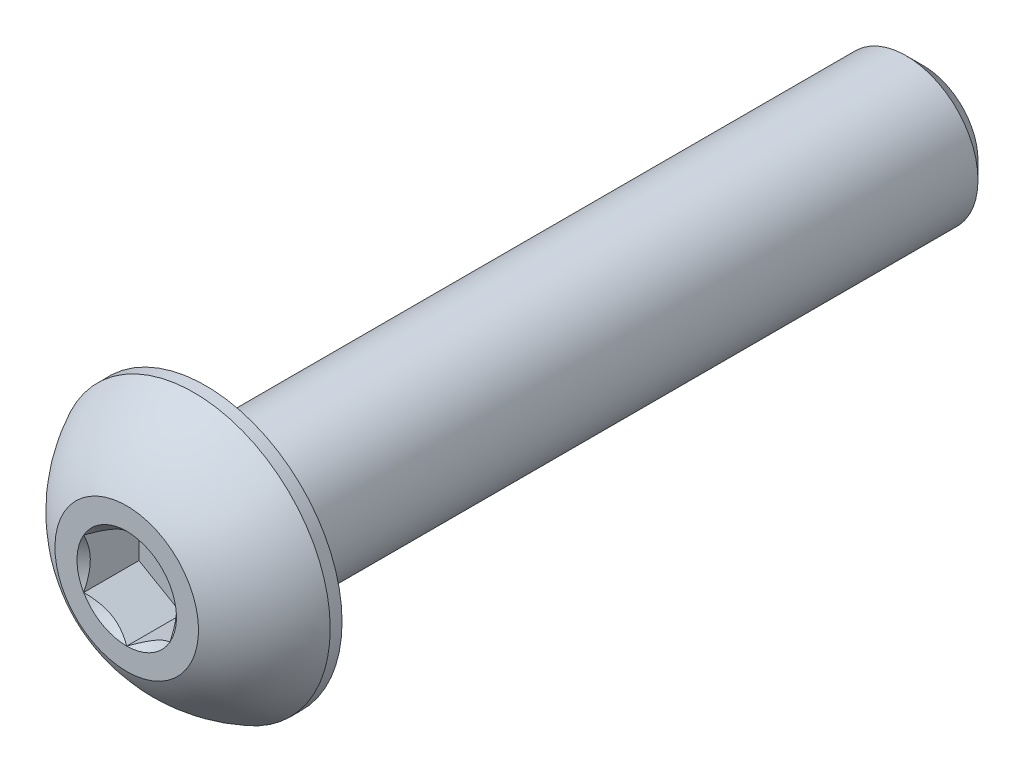
from build123d import *

# Parameters (mm, degrees)
CUT_EXTRUDE2_DEPTH = 1.925


with BuildPart() as part:
    # Sketch10 → Revolve3 (revolve)
    with BuildSketch(Plane(origin=(0, 0, 0), x_dir=(0, 0, -1), z_dir=(1, 0, 0)), mode=Mode.PRIVATE) as revolve3_sk:
        Polygon((27.15, 2.5), (27.75, 1.9), (27.75, 0), (2.75, 0), (2.75, 2.5), align=None)
    revolve(revolve3_sk.sketch.rotate(Axis((0, 0, 0), (0, 0, -1)), 90), axis=Axis((0, 0, 0), (0, 0, -1)))

    # Sketch7 → Revolve2 (revolve)
    with BuildSketch(Plane(origin=(0, 0, 0), x_dir=(0, 0, -1), z_dir=(1, 0, 0)), mode=Mode.PRIVATE) as revolve2_sk:
        with BuildLine():
            Line((2.3375, 4.75), (2.75, 4.75))
            Line((2.75, 4.75), (2.75, 0))
            Line((2.75, 0), (0, 0))
            Line((0, 0), (0, 2.5))
            ThreePointArc((0, 2.5), (0.991875183, 3.808753282), (2.3375, 4.75))
        make_face()
    revolve(revolve2_sk.sketch.rotate(Axis((0, 0, 0), (0, 0, -1)), 180), axis=Axis((0, 0, 0), (0, 0, -1)))

    # Sketch5 → Cut-Extrude2 (cut)
    with BuildSketch(Plane.XY):
        Polygon((1.5, -0.866025404), (1.5, 0.866025404), (0, 1.732050808), (-1.5, 0.866025404), (-1.5, -0.866025404), (0, -1.732050808), align=None)
    extrude(amount=-CUT_EXTRUDE2_DEPTH, mode=Mode.SUBTRACT)

    # Cut-Extrude3 cone 1 section (through the dimple's axis) → Cut-Extrude3 (revolve, cut)
    with BuildSketch(Plane(origin=(0, 0, 0), x_dir=(0, -1, 0), z_dir=(1, 0, 0))):
        Polygon((0, 0), (1.732050808, 0), (0, 1.732050808), align=None)
    revolve(axis=Axis((0, 0, 0), (0, 0, -1)), mode=Mode.SUBTRACT)


with BuildPart() as body_2:
    # Split1: read off the stored shape, not the designer's step
    # Split1: the piece on the far side of the plane
    add(part.part)
    split(bisect_by=Plane.XY.offset(-2.75), keep=Keep.BOTTOM)


with BuildPart() as part_1:
    add(part.part)

    # Split1
    split(bisect_by=Plane.XY.offset(-2.75), keep=Keep.TOP)


with BuildPart() as body_2_1:
    add(body_2.part)

    # Boss-Extrude1: read off the stored shape, not the designer's step
    # Boss-Extrude1: union part
    add(part_1.part)


solid = body_2_1.part
